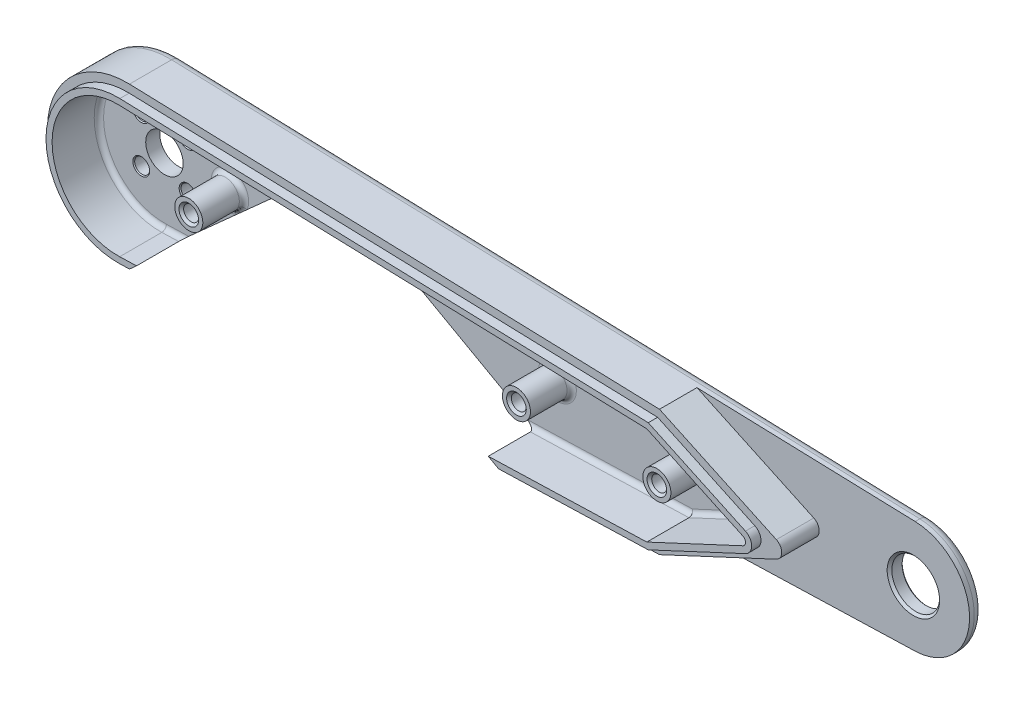
from build123d import *

# Parameters (mm, degrees)
BOSS_EXTRUDE1_DEPTH     = 12
CUT_EXTRUDE7_DEPTH      = 9
CUT_EXTRUDE3_DEPTH      = 175.496418301
CUT_EXTRUDE3_DEPTH_BACK = 175.496418301
SKETCH4_R               = 5.1
SHELL1_START            = -9
SHELL1_DEPTH            = 18
FILLET1_R               = 2
FILLET2_R               = 1
CUT_EXTRUDE8_REACH      = 176.496
SKETCH9_R               = 1.6
SKETCH9_R_2             = 4
CUT_EXTRUDE9_REACH      = 176.496
SKETCH10_R              = 4
BOSS_EXTRUDE2_DEPTH     = 1
CUT_EXTRUDE10_DEPTH     = 1
CUT_EXTRUDE12_REACH     = 175.326
SKETCH17_R              = 3
BOSS_EXTRUDE3_DEPTH     = 8.8
SKETCH20_R              = 1.6
CUT_EXTRUDE13_DEPTH     = 174.326281908
FILLET3_R               = 1
FILLET4_R               = 1
FILLET5_R               = 2
CHAMFER1_SIZE           = 0.5
CHAMFER2_SIZE           = 0.5
CHAMFER3_SIZE           = 0.2
CHAMFER4_SIZE           = 0.2
CHAMFER5_SIZE           = 0.3


# Read off the part's stored shape, not the designer's step: Shell1
with BuildPart() as part:
    # Sketch1 → Boss-Extrude1 (new, symmetric)
    with BuildSketch(Plane.XY):
        with BuildLine():
            Line((0.53125, 16.991697191), (160.375, 11.994139194))
            ThreePointArc((160.375, 11.994139194), (172, 0), (160.375, -11.994139194))
            Line((160.375, -11.994139194), (0.53125, -16.991697191))
            ThreePointArc((0.53125, -16.991697191), (-17, 0), (0.53125, 16.991697191))
        make_face()
    extrude(amount=BOSS_EXTRUDE1_DEPTH, both=True)

    # Sketch8 → Cut-Extrude7 (cut, symmetric)
    with BuildSketch(Plane.XY):
        with BuildLine():
            Line((113.761983187, 13.451507749), (142.608834646, 0))
            Line((142.608834646, 0), (113.761983187, -13.451507749))
            Line((113.761983187, -13.451507749), (160.375, -11.994139194))
            ThreePointArc((160.375, -11.994139194), (172, 0), (160.375, 11.994139194))
            Line((160.375, 11.994139194), (113.761983187, 13.451507749))
        make_face()
    extrude(amount=CUT_EXTRUDE7_DEPTH, both=True, mode=Mode.SUBTRACT)

    # Sketch4 → Cut-Extrude3 (cut, two sides: drawn at the far end of the back side and taken through both)
    with BuildSketch(Plane.XY.offset(12).offset(-CUT_EXTRUDE3_DEPTH_BACK)):
        with Locations((160, 0)):
            Circle(SKETCH4_R)
    extrude(amount=CUT_EXTRUDE3_DEPTH + CUT_EXTRUDE3_DEPTH_BACK, mode=Mode.SUBTRACT)

    # Shell1 outline → Shell1 (cut)
    with BuildSketch(Plane.XY.offset(SHELL1_START)):
        with BuildLine():
            Line((0.4375, -13.993162393), (113.052471085, -10.472224919))
            Line((113.052471085, -10.472224919), (135.510229896, 0))
            Line((135.510229896, 0), (113.052471085, 10.472224919))
            Line((113.052471085, 10.472224919), (0.4375, 13.993162393))
            ThreePointArc((0.4375, 13.993162393), (-14, 0), (0.4375, -13.993162393))
        make_face()
    extrude(amount=SHELL1_DEPTH, mode=Mode.SUBTRACT)

    # Fillet1
    fillet1_edges = [part.edges().sort_by_distance(p)[0] for p in [
        (142.608834646, 0, 0),
    ]]
    fillet(fillet1_edges, radius=FILLET1_R)

    # Fillet2
    fillet2_edges = [part.edges().sort_by_distance(p)[0] for p in [
        (135.510229896, 0, 0),
    ]]
    fillet(fillet2_edges, radius=FILLET2_R)

    # Sketch9 → Cut-Extrude8 (cut, up to next)
    with BuildSketch(Plane(origin=(0, 0, -12), x_dir=(-1, 0, 0), z_dir=(0, 0, -1)), mode=Mode.PRIVATE) as cut_extrude8_sk1:
        with Locations((-4.949747468, 4.949747468)):
            Circle(SKETCH9_R)
    cut_extrude8_tool1 = extrude(cut_extrude8_sk1.sketch, amount=-CUT_EXTRUDE8_REACH, mode=Mode.PRIVATE) & part.part
    # Sketch9 → Cut-Extrude8 (cut, up to next)
    with BuildSketch(Plane(origin=(0, 0, -12), x_dir=(-1, 0, 0), z_dir=(0, 0, -1)), mode=Mode.PRIVATE) as cut_extrude8_sk2:
        with Locations((4.949747468, 4.949747468)):
            Circle(SKETCH9_R)
    cut_extrude8_tool2 = extrude(cut_extrude8_sk2.sketch, amount=-CUT_EXTRUDE8_REACH, mode=Mode.PRIVATE) & part.part
    # Sketch9 → Cut-Extrude8 (cut, up to next)
    with BuildSketch(Plane(origin=(0, 0, -12), x_dir=(-1, 0, 0), z_dir=(0, 0, -1)), mode=Mode.PRIVATE) as cut_extrude8_sk3:
        with Locations((4.949747468, -4.949747468)):
            Circle(SKETCH9_R)
    cut_extrude8_tool3 = extrude(cut_extrude8_sk3.sketch, amount=-CUT_EXTRUDE8_REACH, mode=Mode.PRIVATE) & part.part
    # Sketch9 → Cut-Extrude8 (cut, up to next)
    with BuildSketch(Plane(origin=(0, 0, -12), x_dir=(-1, 0, 0), z_dir=(0, 0, -1)), mode=Mode.PRIVATE) as cut_extrude8_sk4:
        with Locations((-4.949747468, -4.949747468)):
            Circle(SKETCH9_R)
    cut_extrude8_tool4 = extrude(cut_extrude8_sk4.sketch, amount=-CUT_EXTRUDE8_REACH, mode=Mode.PRIVATE) & part.part
    # Sketch9 → Cut-Extrude8 (cut, up to next)
    with BuildSketch(Plane(origin=(0, 0, -12), x_dir=(-1, 0, 0), z_dir=(0, 0, -1)), mode=Mode.PRIVATE) as cut_extrude8_sk5:
        Circle(SKETCH9_R_2)
    cut_extrude8_tool5 = extrude(cut_extrude8_sk5.sketch, amount=-CUT_EXTRUDE8_REACH, mode=Mode.PRIVATE) & part.part
    add(cut_extrude8_tool1.solids().sort_by_distance((4.949747, 4.949747, -12))[0], mode=Mode.SUBTRACT)
    add(cut_extrude8_tool2.solids().sort_by_distance((-4.949747, 4.949747, -12))[0], mode=Mode.SUBTRACT)
    add(cut_extrude8_tool3.solids().sort_by_distance((-4.949747, -4.949747, -12))[0], mode=Mode.SUBTRACT)
    add(cut_extrude8_tool4.solids().sort_by_distance((4.949747, -4.949747, -12))[0], mode=Mode.SUBTRACT)
    add(cut_extrude8_tool5.solids().sort_by_distance((0, 0, -12))[0], mode=Mode.SUBTRACT)

    # Sketch10 → Cut-Extrude9 (cut, up to next)
    with BuildSketch(Plane.XY.offset(12), mode=Mode.PRIVATE) as cut_extrude9_sk1:
        with Locations(Location((0, 0, 0), (0, 0, 180))):
            Circle(SKETCH10_R)
    cut_extrude9_tool1 = extrude(cut_extrude9_sk1.sketch, amount=-CUT_EXTRUDE9_REACH, mode=Mode.PRIVATE) & part.part
    add(cut_extrude9_tool1.solids().sort_by_distance((0, 0, 12))[0], mode=Mode.SUBTRACT)

    # SurfaceCut1
    split(bisect_by=Plane.XY, keep=Keep.BOTTOM)

    # Sketch12 → Boss-Extrude2 (add)
    with BuildSketch(Plane.XY):
        with BuildLine():
            Line((113.359926329, 11.763247478), (0.478125, 15.292527472))
            ThreePointArc((0.478125, 15.292527472), (-15.3, 0), (0.478125, -15.292527472))
            Line((0.478125, -15.292527472), (113.359926329, -11.763247478))
            Line((113.359926329, -11.763247478), (134.116050315, -2.08450791))
            ThreePointArc((134.116050315, -2.08450791), (135.444028313, 0), (134.116050315, 2.08450791))
            Line((134.116050315, 2.08450791), (113.359926329, 11.763247478))
        make_face()
        with BuildLine():
            Line((113.052471085, 10.472224919), (0.4375, 13.993162393))
            ThreePointArc((0.4375, 13.993162393), (-14, 0), (0.4375, -13.993162393))
            Line((0.4375, -13.993162393), (113.052471085, -10.472224919))
            Line((113.052471085, -10.472224919), (133.566646575, -0.906307787))
            ThreePointArc((133.566646575, -0.906307787), (134.144028313, 0), (133.566646575, 0.906307787))
            Line((133.566646575, 0.906307787), (113.052471085, 10.472224919))
        make_face(mode=Mode.SUBTRACT)
    extrude(amount=BOSS_EXTRUDE2_DEPTH)

    # Sketch13 → Cut-Extrude10 (cut)
    with BuildSketch(Plane.XY):
        with BuildLine():
            Line((113.761983187, 13.451507749), (0.53125, 16.991697191))
            ThreePointArc((0.53125, 16.991697191), (-17, 0), (0.53125, -16.991697191))
            Line((0.53125, -16.991697191), (113.761983187, -13.451507749))
            Line((113.761983187, -13.451507749), (138.721668003, -1.812615574))
            ThreePointArc((138.721668003, -1.812615574), (139.876431479, 0), (138.721668003, 1.812615574))
            Line((138.721668003, 1.812615574), (113.761983187, 13.451507749))
        make_face()
        with BuildLine():
            Line((113.359926329, 11.763247478), (0.478125, 15.292527472))
            ThreePointArc((0.478125, 15.292527472), (-15.3, 0), (0.478125, -15.292527472))
            Line((0.478125, -15.292527472), (113.359926329, -11.763247478))
            Line((113.359926329, -11.763247478), (134.116050315, -2.08450791))
            ThreePointArc((134.116050315, -2.08450791), (135.444028313, 0), (134.116050315, 2.08450791))
            Line((134.116050315, 2.08450791), (113.359926329, 11.763247478))
        make_face(mode=Mode.SUBTRACT)
    extrude(amount=-CUT_EXTRUDE10_DEPTH, mode=Mode.SUBTRACT)

    # Sketch15 → Cut-Extrude12 (cut, up to next)
    with BuildSketch(Plane(origin=(0, 0, -12), x_dir=(-1, 0, 0), z_dir=(0, 0, -1)), mode=Mode.PRIVATE) as cut_extrude12_sk1:
        with BuildLine():
            Line((-84.263099493, -14.373798311), (-0.571708086, -16.990432258))
            Line((-0.571708086, -16.990432258), (-28.656879553, 8.190151531))
            ThreePointArc((-28.656879553, 8.190151531), (-34.785585937, 10.932758046), (-41.366766264, 9.601969583))
            Line((-41.366766264, 9.601969583), (-84.263099493, -14.373798311))
        make_face()
    cut_extrude12_tool1 = extrude(cut_extrude12_sk1.sketch, amount=-CUT_EXTRUDE12_REACH, mode=Mode.PRIVATE) & part.part
    add(cut_extrude12_tool1.solids().sort_by_distance((39.828066, -6.13947, -12))[0], mode=Mode.SUBTRACT)

    # Sketch17 → Boss-Extrude3 (add)
    with BuildSketch(Plane.XY.offset(-9)):
        with Locations((14, 0)):
            Circle(SKETCH17_R)
        with Locations((84, 0)):
            Circle(SKETCH17_R)
        with Locations((114, 0)):
            Circle(SKETCH17_R)
    extrude(amount=BOSS_EXTRUDE3_DEPTH)

    # Sketch20 → Cut-Extrude13 (cut, through all)
    with BuildSketch(Plane(origin=(0, 0, -12), x_dir=(-1, 0, 0), z_dir=(0, 0, -1))):
        with Locations((-14, 0)):
            Circle(SKETCH20_R)
        with Locations((-84, 0)):
            Circle(SKETCH20_R)
        with Locations((-114, 0)):
            Circle(SKETCH20_R)
    extrude(amount=-CUT_EXTRUDE13_DEPTH, mode=Mode.SUBTRACT)

    # Fillet3
    fillet3_edges = [part.edges().sort_by_distance(p)[0] for p in [
        (11, 0, -9),
        (81, 0, -9),
        (111, 0, -9),
    ]]
    fillet(fillet3_edges, radius=FILLET3_R)

    # Fillet4
    fillet4_edges = [part.edges().sort_by_distance(p)[0] for p in [
        (96.11498359, -11.001780038, -9),
        (2.238925782, -13.93684033, -9),
        (56.744985542, 12.232693656, -9),
        (-14, 0, -9),
        (123.30955883, 5.689266353, -9),
        (123.30955883, -5.689266353, -9),
        (134.144028313, 0, -9),
    ]]
    fillet(fillet4_edges, radius=FILLET4_R)

    # Fillet5
    fillet5_edges = [part.edges().sort_by_distance(p)[0] for p in [
        (122.319049746, -13.183968753, -12),
        (80.453125, 14.492918192, -12),
        (172, 0, -12),
        (0.551479043, -16.991064725, -12),
        (-17, 0, -12),
    ]]
    fillet(fillet5_edges, radius=FILLET5_R)

    # Chamfer1
    chamfer1_edges = [part.edges().sort_by_distance(p)[0] for p in [
        (154.9, 0, -9),
    ]]
    chamfer(chamfer1_edges, length=CHAMFER1_SIZE)

    # Chamfer2
    chamfer2_edges = [part.edges().sort_by_distance(p)[0] for p in [
        (15.6, 0, -0.2),
        (85.6, 0, -0.2),
        (115.6, 0, -0.2),
    ]]
    chamfer(chamfer2_edges, length=CHAMFER2_SIZE)

    # Chamfer3
    chamfer3_edges = [part.edges().sort_by_distance(p)[0] for p in [
        (85.6, 0, -12),
        (115.6, 0, -12),
    ]]
    chamfer(chamfer3_edges, length=CHAMFER3_SIZE)

    # Chamfer4
    chamfer4_edges = [part.edges().sort_by_distance(p)[0] for p in [
        (6.549747468, 4.949747468, -9),
        (6.549747468, -4.949747468, -9),
        (-3.349747468, -4.949747468, -9),
        (-3.349747468, 4.949747468, -9),
    ]]
    chamfer(chamfer4_edges, length=CHAMFER4_SIZE)

    # Chamfer5
    chamfer5_edges = [part.edges().sort_by_distance(p)[0] for p in [
        (154.9, 0, -12),
    ]]
    chamfer(chamfer5_edges, length=CHAMFER5_SIZE)


solid = part.part
